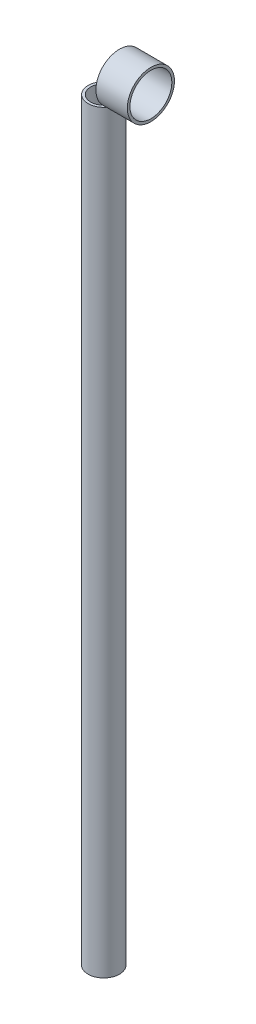
from build123d import *

# Parameters (mm, degrees)
SKETCH1_R           = 19.05
SKETCH1_R_2         = 15.875
BOSS_EXTRUDE1_DEPTH = 914.4
SKETCH2_R           = 28.575
SKETCH2_R_2         = 25.4
BOSS_EXTRUDE2_DEPTH = 57.15
SKETCH3_R           = 28.575
SKETCH3_R_2         = 25.4
CUT_EXTRUDE1_DEPTH  = 19.05


with BuildPart() as part:
    # Sketch1 → Boss-Extrude1 (new body)
    with BuildSketch(Plane(origin=(0, 0, 0), x_dir=(1, 0, 0), z_dir=(0, 1, 0))):
        Circle(SKETCH1_R)
        Circle(SKETCH1_R_2, mode=Mode.SUBTRACT)
    extrude(amount=BOSS_EXTRUDE1_DEPTH)


with BuildPart() as body_2:
    # Sketch2 → Boss-Extrude2 (new body)
    with BuildSketch(Plane(origin=(0, 0, 0), x_dir=(0, 0, -1), z_dir=(1, 0, 0))):
        with Locations((0, 942.975)):
            Circle(SKETCH2_R)
        with Locations((0, 942.975)):
            Circle(SKETCH2_R_2, mode=Mode.SUBTRACT)
    extrude(amount=BOSS_EXTRUDE2_DEPTH)

    # Sketch3 → Cut-Extrude1 (cut)
    with BuildSketch(Plane.ZY):
        with Locations((0, 942.975)):
            Circle(SKETCH3_R)
        with Locations((0, 942.975)):
            Circle(SKETCH3_R_2, mode=Mode.SUBTRACT)
    extrude(amount=-CUT_EXTRUDE1_DEPTH, mode=Mode.SUBTRACT)


solid = Compound([part.part, body_2.part])
